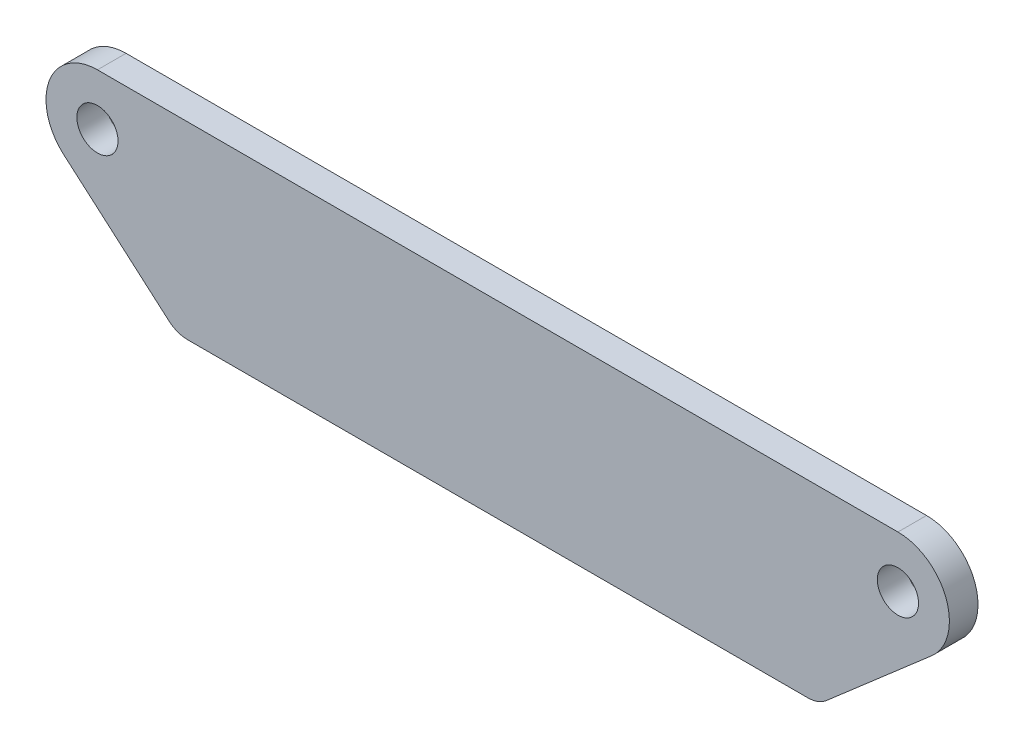
from build123d import *

# Parameters (mm, degrees)
SKETCH1_R           = 2.286
BOSS_EXTRUDE1_DEPTH = 3.175


with BuildPart() as part:
    # Sketch1 → Boss-Extrude1 (new body)
    with BuildSketch(Plane.XY):
        with BuildLine():
            Line((-3.747467174, 2.035175), (7.936110478, -8.112125))
            ThreePointArc((7.936110478, -8.112125), (8.906786685, -8.689180297), (10.018036685, -8.89))
            Line((10.018036685, -8.89), (78.881963315, -8.89))
            ThreePointArc((78.881963315, -8.89), (79.993213315, -8.689180297), (80.963889522, -8.112125))
            Line((80.963889522, -8.112125), (92.647467174, 2.035175))
            ThreePointArc((92.647467174, 2.035175), (94.253524534, 8.35025), (88.9, 12.065))
            Line((88.9, 12.065), (0, 12.065))
            ThreePointArc((0, 12.065), (-5.353524534, 8.35025), (-3.747467174, 2.035175))
        make_face()
        with Locations((0, 6.35)):
            Circle(SKETCH1_R, mode=Mode.SUBTRACT)
        with Locations((88.9, 6.35)):
            Circle(SKETCH1_R, mode=Mode.SUBTRACT)
    extrude(amount=BOSS_EXTRUDE1_DEPTH)


solid = part.part
